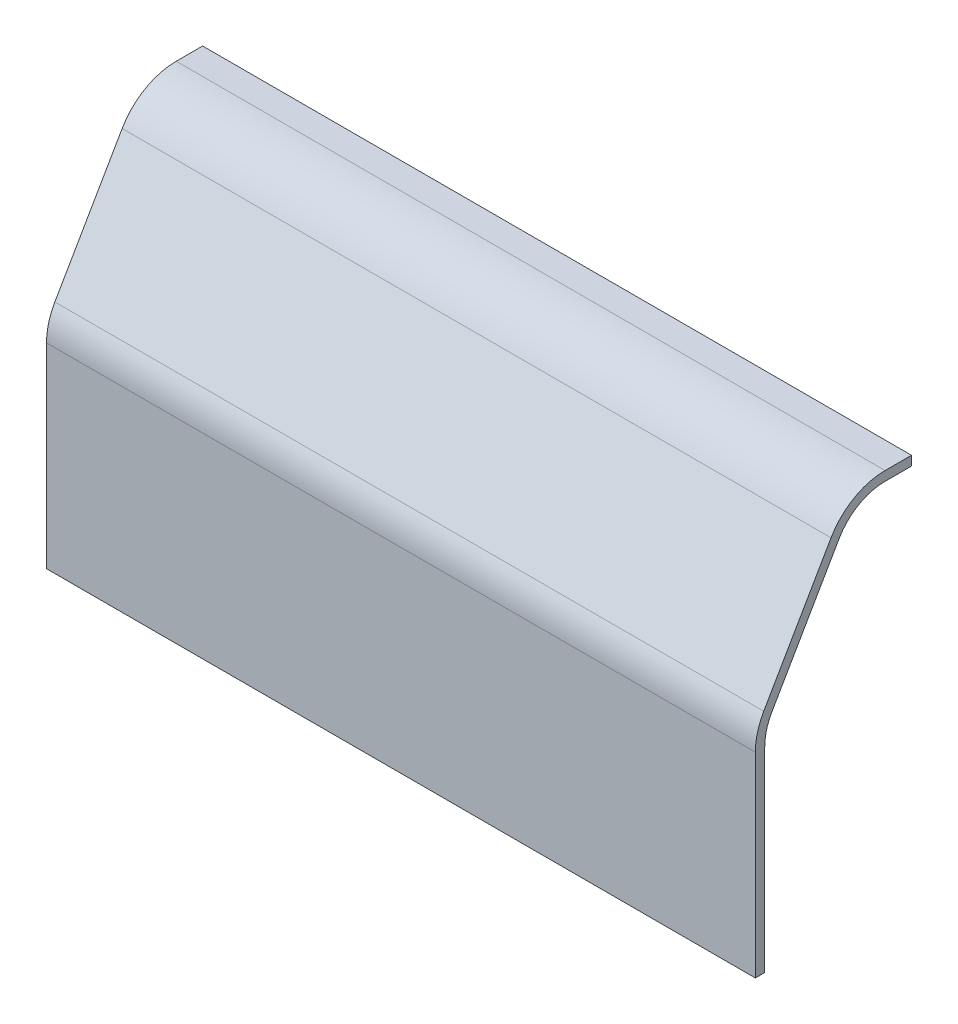
from build123d import *

# Parameters (mm, degrees)
SALIENTE_EXTRUIR1_DEPTH = 113.5
REDONDEO1_R             = 20
REDONDEO2_R             = 20
REDONDEO3_R             = 17
REDONDEO4_R             = 17


with BuildPart() as part:
    # Croquis1 → Saliente-Extruir1 (new, symmetric)
    with BuildSketch(Plane(origin=(0, 0, 0), x_dir=(0, 0, -1), z_dir=(1, 0, 0))):
        Polygon((0, 0), (0, 67.196152423), (28.732050808, 116.961524227), (47, 116.961524227), (47, 119.961524227), (27, 119.961524227), (-3, 68), (-3, 0), align=None)
    extrude(amount=SALIENTE_EXTRUIR1_DEPTH, both=True)

    # Redondeo1
    redondeo1_edges = [part.edges().sort_by_distance(p)[0] for p in [
        (0, 68, 3),
    ]]
    fillet(redondeo1_edges, radius=REDONDEO1_R)

    # Redondeo2
    redondeo2_edges = [part.edges().sort_by_distance(p)[0] for p in [
        (0, 119.961524227, -27),
    ]]
    fillet(redondeo2_edges, radius=REDONDEO2_R)

    # Redondeo3
    redondeo3_edges = [part.edges().sort_by_distance(p)[0] for p in [
        (0, 116.961524227, -28.732050808),
    ]]
    fillet(redondeo3_edges, radius=REDONDEO3_R)

    # Redondeo4
    redondeo4_edges = [part.edges().sort_by_distance(p)[0] for p in [
        (0, 67.196152423, 0),
    ]]
    fillet(redondeo4_edges, radius=REDONDEO4_R)


solid = part.part
